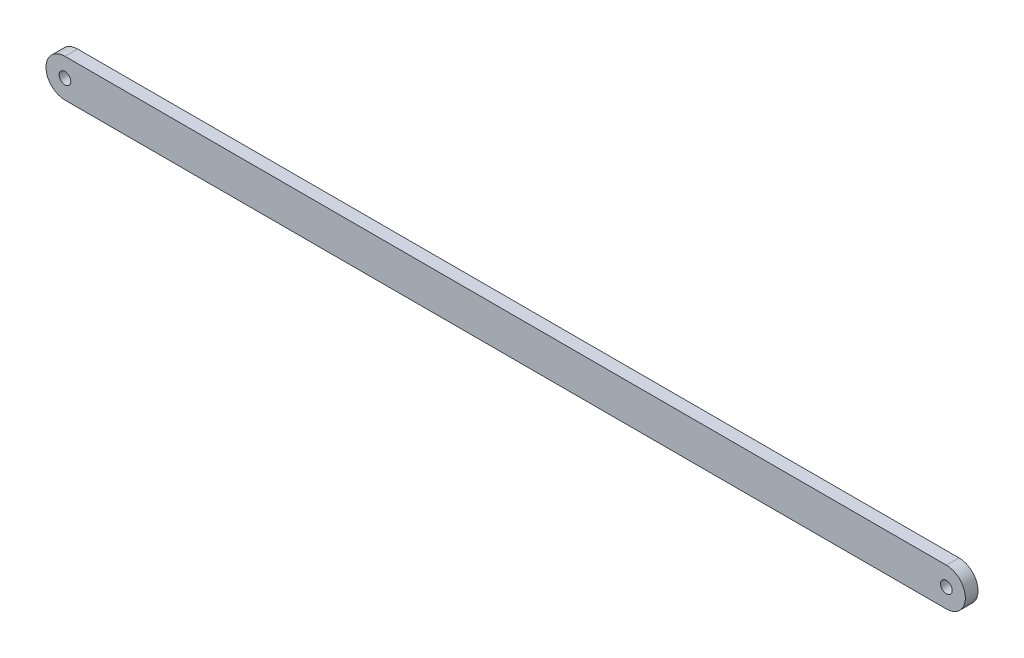
from build123d import *

# Parameters (mm, degrees)
SKETCH_1_R      = 2.3
EXTRUDE_1_DEPTH = 5


with BuildPart() as part:
    # 草图1 → 凸台-拉伸1 (new body)
    with BuildSketch(Plane.XY):
        with BuildLine():
            Line((-174.249390243, 7.5), (174.249390243, 7.5))
            ThreePointArc((174.249390243, 7.5), (181.749390243, 0), (174.249390243, -7.5))
            Line((174.249390243, -7.5), (-174.249390243, -7.5))
            ThreePointArc((-174.249390243, -7.5), (-181.749390243, 0), (-174.249390243, 7.5))
        make_face()
        with Locations((-174.249390243, 0)):
            Circle(SKETCH_1_R, mode=Mode.SUBTRACT)
        with Locations((174.249390243, 0)):
            Circle(SKETCH_1_R, mode=Mode.SUBTRACT)
    extrude(amount=EXTRUDE_1_DEPTH)


solid = part.part
